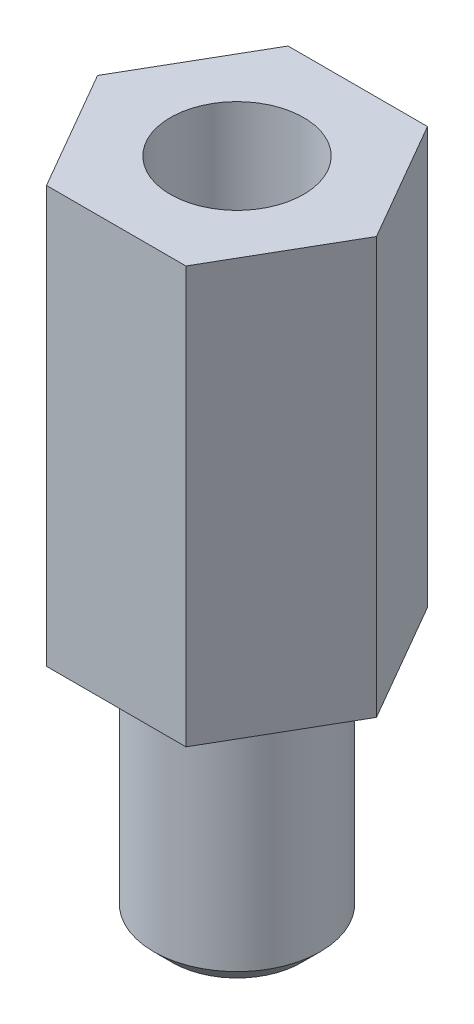
from build123d import *

# Parameters (mm, degrees)
BOSS_EXTRUDE1_DEPTH       = 5
M2X0_4_TAPPED_HOLE1_D     = 1.6
M2X0_4_TAPPED_HOLE1_DEPTH = 3
M2X0_4_TAPPED_HOLE1_TIP   = 0.480688495


# Read off the part's stored shape, not the designer's step: M2x0.4 Machine Threads Stud1
with BuildPart() as part:
    # Sketch1 → Boss-Extrude1 (new body)
    with BuildSketch(Plane(origin=(0, 0, 0), x_dir=(1, 0, 0), z_dir=(0, 1, 0))):
        Polygon((-0.83715789, -1.45), (0.83715789, -1.45), (1.674315781, 0), (0.83715789, 1.45), (-0.83715789, 1.45), (-1.674315781, 0), align=None)
    extrude(amount=BOSS_EXTRUDE1_DEPTH)

    # M2x0.4 Machine Threads Stud1 outline → M2x0.4 Machine Threads Stud1 (revolve)
    with BuildSketch(Plane.XY):
        Polygon((0, 0), (0, -3), (0.774, -3), (1, -2.774), (1, 0), align=None)
    revolve(axis=Axis((0, 0, 0), (0, 1, 0)))

    # M2x0.4 Tapped Hole1
    with Locations(Plane(origin=(0, 5, 0), x_dir=(1, 0, 0), z_dir=(0, 1, 0))):
        with Locations((0, 0)):
            Hole(M2X0_4_TAPPED_HOLE1_D / 2, depth=M2X0_4_TAPPED_HOLE1_DEPTH)
            with Locations((0, 0, -(M2X0_4_TAPPED_HOLE1_DEPTH + M2X0_4_TAPPED_HOLE1_TIP / 2))):  # 118° drill point
                Cone(0, M2X0_4_TAPPED_HOLE1_D / 2, M2X0_4_TAPPED_HOLE1_TIP, mode=Mode.SUBTRACT)


solid = part.part
